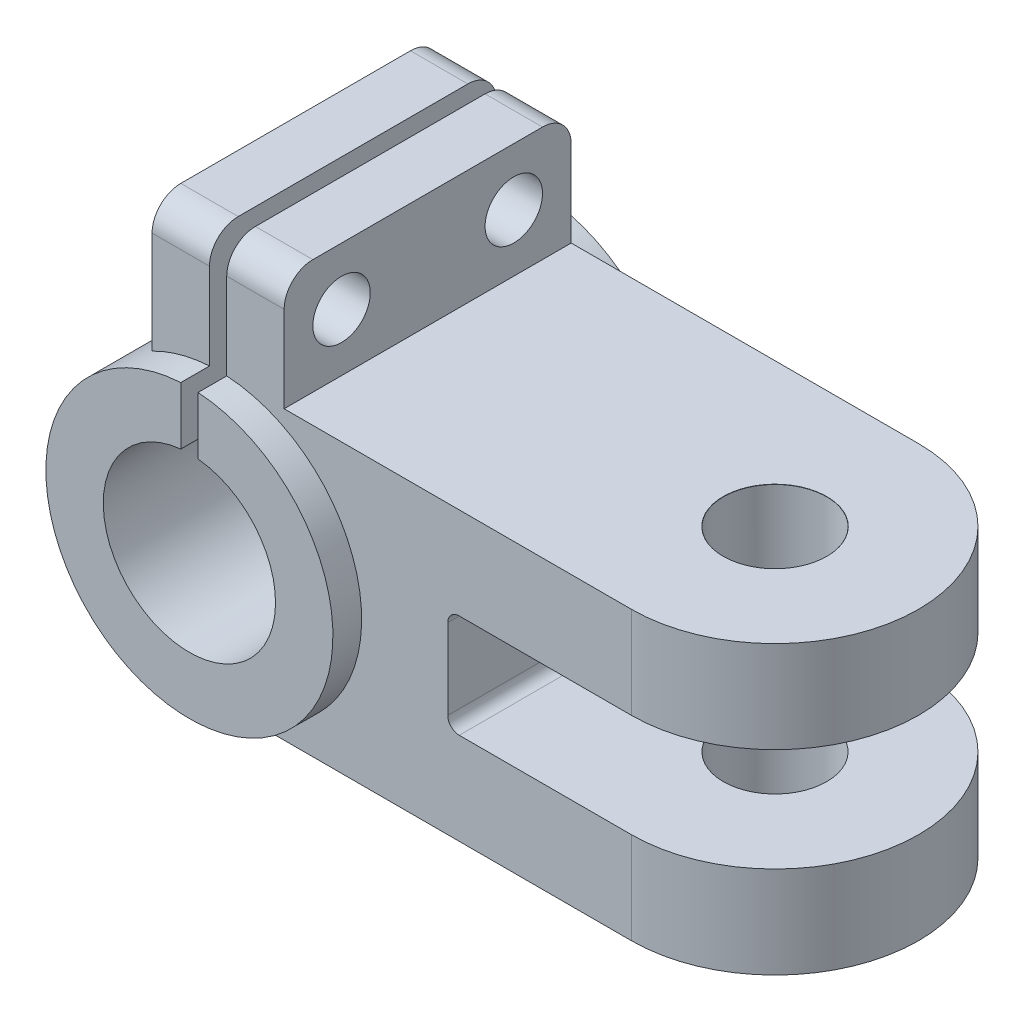
from build123d import *
from OCP.BRepAlgoAPI import BRepAlgoAPI_Cut
from OCP.TopTools import TopTools_ListOfShape

# Parameters (mm, degrees)
SCHIZZO1_R                   = 25
SCHIZZO1_R_2                 = 15
ESTRUSIONE_ESTRUSIONE1_DEPTH = 30
ESTRUSIONE_ESTRUSIONE2_DEPTH = 25
TAGLIO_ESTRUSIONE1_DEPTH     = 123.613212991
FORO_18_0_18_1_D             = 18
FORO_18_0_18_1_CSINK_D       = 18.05
FORO_18_0_18_1_CSINK_ANGLE   = 90
FORO_10_0_10_1_D             = 10
FORO_10_0_10_1_CSINK_D       = 10.05
FORO_10_0_10_1_CSINK_ANGLE   = 90
TAGLIO_ESTRUSIONE2_START     = -51
TAGLIO_ESTRUSIONE2_DEPTH     = 51
RACCORDO1_R                  = 5


with BuildPart() as part:
    # Schizzo1 → Estrusione-Estrusione1 (new, symmetric)
    with BuildSketch(Plane.XY):
        Circle(SCHIZZO1_R)
        Circle(SCHIZZO1_R_2, mode=Mode.SUBTRACT)
    extrude(amount=ESTRUSIONE_ESTRUSIONE1_DEPTH, both=True)

    # Schizzo1<6> → Estrusione-Estrusione2 (add, symmetric)
    with BuildSketch(Plane.XY):
        with BuildLine():
            Line((11.5, 45), (-11.5, 45))
            Line((-11.5, 45), (-11.5, 22.19797288))
            ThreePointArc((-11.5, 22.19797288), (12.990381057, 21.360009363), (25, 0))
            ThreePointArc((25, 0), (17.67766953, -17.67766953), (0, -25))
            Line((0, -25), (97, -25))
            Line((97, -25), (97, -9))
            Line((97, -9), (42, -9))
            ThreePointArc((42, -9), (40.585786438, -8.414213562), (40, -7))
            Line((40, -7), (40, 7))
            ThreePointArc((40, 7), (40.585786438, 8.414213562), (42, 9))
            Line((42, 9), (97, 9))
            Line((97, 9), (97, 25))
            Line((97, 25), (11.5, 25))
            Line((11.5, 25), (11.5, 45))
        make_face()
    extrude(amount=ESTRUSIONE_ESTRUSIONE2_DEPTH, both=True)

    # Schizzo3 → Taglio-Estrusione1 (cut, through all)
    with BuildSketch(Plane.XY.offset(30)):
        Polygon((1.5, 45), (-1.5, 45), (-1.5, 14.924811557), (0, 15), (1.5, 14.924811557), align=None)
    extrude(amount=-TAGLIO_ESTRUSIONE1_DEPTH, mode=Mode.SUBTRACT)

    # Foro Ø18.0 (18)-1 (through all)
    with Locations(Plane(origin=(71.999996961, 25, 6.74e-07), x_dir=(1, 0, 0), z_dir=(0, 1, 0))):
        with Locations((0, 0)):
            CounterSinkHole(FORO_18_0_18_1_D / 2, FORO_18_0_18_1_CSINK_D / 2, counter_sink_angle=FORO_18_0_18_1_CSINK_ANGLE)

    # Foro Ø10.0 (10)-1 (through all)
    with Locations(Plane(origin=(-11.5, 35, 15), x_dir=(0, 0, -1), z_dir=(-1, 0, 0))):
        with Locations((0, 0), (30, 0)):
            CounterSinkHole(FORO_10_0_10_1_D / 2, FORO_10_0_10_1_CSINK_D / 2, counter_sink_angle=FORO_10_0_10_1_CSINK_ANGLE)


with BuildPart() as taglio_estrusione2_tool:
    # Taglio-Estrusione2: read off the stored shape, not the designer's step
    # Taglio-Estrusione2 outline → Taglio-Estrusione2 (new body)
    with BuildSketch(Plane(origin=(0, 25, 0), x_dir=(1, 0, 0), z_dir=(0, 1, 0)).offset(TAGLIO_ESTRUSIONE2_START)):
        with BuildLine():
            Line((97, 25), (71.999996961, 25))
            ThreePointArc((71.999996961, 25), (89.677666491, 17.67766953), (96.999996961, 0))
            Line((96.999996961, 0), (97, 25))
        make_face()
        with BuildLine():
            Line((97, -25), (96.999996961, 0))
            ThreePointArc((96.999996961, 0), (89.677666491, -17.67766953), (71.999996961, -25))
            Line((71.999996961, -25), (97, -25))
        make_face()
    extrude(amount=TAGLIO_ESTRUSIONE2_DEPTH)


with BuildPart() as part_1:
    add(part.part)

    # Taglio-Estrusione2: cut by taglio_estrusione2_tool, with a tolerance
    taglio_estrusione2_stock = TopTools_ListOfShape()
    taglio_estrusione2_stock.Append(part_1.part.wrapped)
    taglio_estrusione2_tools = TopTools_ListOfShape()
    taglio_estrusione2_tools.Append(taglio_estrusione2_tool.part.wrapped)
    taglio_estrusione2_cut = BRepAlgoAPI_Cut()
    taglio_estrusione2_cut.SetArguments(taglio_estrusione2_stock)
    taglio_estrusione2_cut.SetTools(taglio_estrusione2_tools)
    taglio_estrusione2_cut.SetFuzzyValue(0.00001)
    taglio_estrusione2_cut.Build()
    add(Compound.cast(taglio_estrusione2_cut.Shape()).solids(), mode=Mode.REPLACE)

    # Raccordo1
    raccordo1_edges = [part_1.edges().sort_by_distance(p)[0] for p in [
        (-6.5, 45, 25),
        (-6.5, 45, -25),
        (6.5, 45, -25),
        (6.5, 45, 25),
    ]]
    fillet(raccordo1_edges, radius=RACCORDO1_R)


solid = part_1.part
